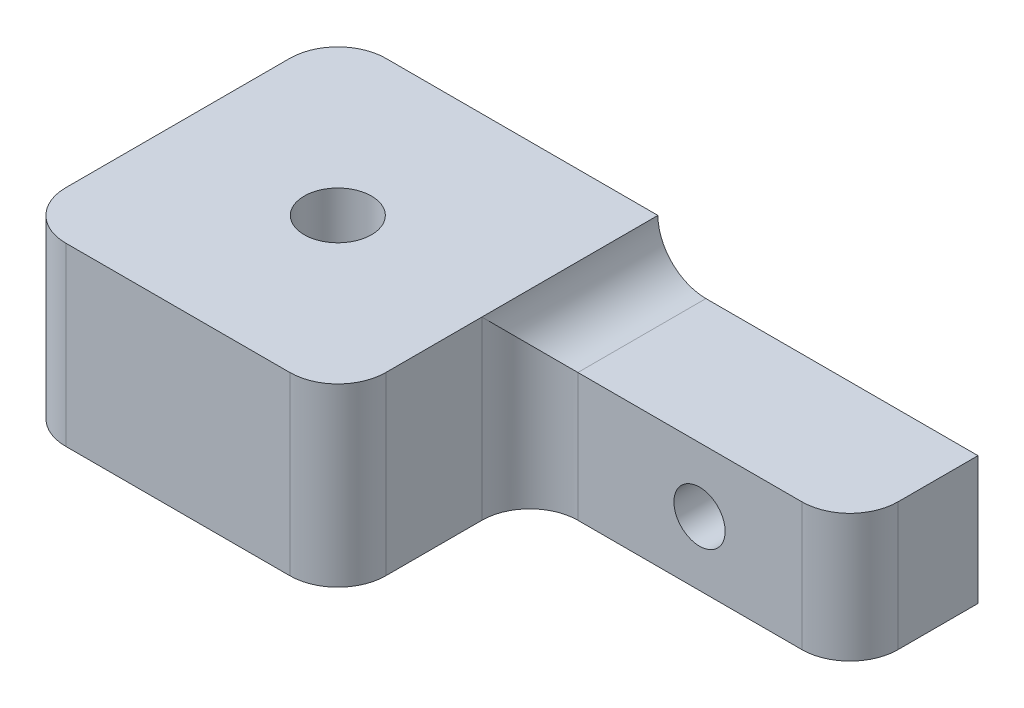
from build123d import *

# Parameters (mm, degrees)
ESQUISSE1_W             = 40
ESQUISSE1_H             = 8
BOSS_EXTRU_1_DEPTH      = 8
ESQUISSE2_W             = 20
ESQUISSE2_H             = 8
BOSS_EXTRU_2_DEPTH      = 12
ESQUISSE3_W             = 20
ESQUISSE3_H             = 20
BOSS_EXTRU_3_DEPTH      = 3
CONG_1_R                = 3
ESQUISSE4_R             = 1.6
ENL_V_MAT_EXTRU_1_DEPTH = 47.054315759
ESQUISSE5_R             = 2.1
ENL_V_MAT_EXTRU_2_DEPTH = 47.054315759


with BuildPart() as part:
    # Esquisse1 → Boss.-Extru.1 (new body)
    with BuildSketch(Plane.XY):
        with Locations((20, 4)):
            Rectangle(ESQUISSE1_W, ESQUISSE1_H)
    extrude(amount=BOSS_EXTRU_1_DEPTH)

    # Esquisse2 → Boss.-Extru.2 (add)
    with BuildSketch(Plane.XY.offset(8)):
        with Locations((10, 4)):
            Rectangle(ESQUISSE2_W, ESQUISSE2_H)
    extrude(amount=BOSS_EXTRU_2_DEPTH)

    # Esquisse3 → Boss.-Extru.3 (add)
    with BuildSketch(Plane(origin=(0, 8, 0), x_dir=(1, 0, 0), z_dir=(0, 1, 0))):
        with Locations((10, -10)):
            Rectangle(ESQUISSE3_W, ESQUISSE3_H)
    extrude(amount=BOSS_EXTRU_3_DEPTH)

    # Congé1
    cong_1_edges = [part.edges().sort_by_distance(p)[0] for p in [
        (20, 5.5, 20),
        (40, 4, 8),
        (0, 5.5, 0),
        (0, 5.5, 20),
        (20, 4, 8),
        (20, 8, 4),
    ]]
    fillet(cong_1_edges, radius=CONG_1_R - 0.0001)  # a hair under: the kernel refuses the full size

    # Esquisse4 → Enlèv. mat.-Extru.1 (cut, through all)
    with BuildSketch(Plane(origin=(0, 0, 0), x_dir=(-1, 0, 0), z_dir=(0, 0, -1))):
        with Locations((-30.6, 4)):
            Circle(ESQUISSE4_R)
    extrude(amount=-ENL_V_MAT_EXTRU_1_DEPTH, mode=Mode.SUBTRACT)

    # Esquisse5 → Enlèv. mat.-Extru.2 (cut, through all)
    with BuildSketch(Plane.XZ):
        with Locations(Location((10, 10, 0), (0, 0, 270))):
            Circle(ESQUISSE5_R)
    extrude(amount=-ENL_V_MAT_EXTRU_2_DEPTH, mode=Mode.SUBTRACT)


solid = part.part
